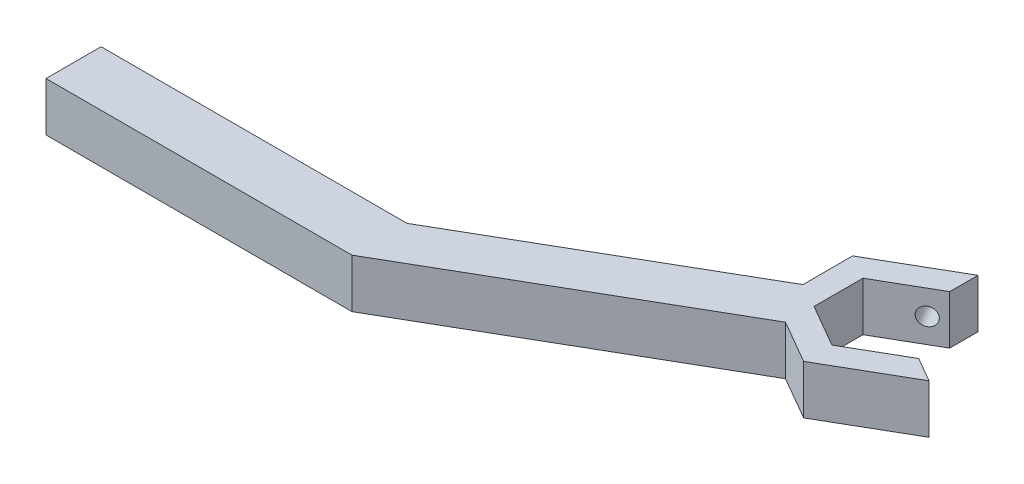
from build123d import *

# Parameters (mm, degrees)
SKETCH1_R           = 2.5
BOSS_EXTRUDE1_DEPTH = 4
BOSS_EXTRUDE2_START = 4
BOSS_EXTRUDE2_DEPTH = 4
SKETCH4_R           = 1.45
CUT_EXTRUDE1_DEPTH  = 4


# Read off the part's stored shape, not the designer's step: Boss-Extrude2
with BuildPart() as part:
    # Sketch1 → Boss-Extrude1 (new body)
    with BuildSketch(Plane(origin=(0, 0, 0), x_dir=(1, 0, 0), z_dir=(0, 1, 0))):
        Polygon((-4.5, -4.5), (45.5, -4.5), (90.417468245, 21.433112383), (97.448557159, 17.373711306), (110.438938215, 24.873711306), (106.438938215, 27.183112383), (104.376760389, 25.992513459), (97.448557159, 21.992513459), (90.520353928, 25.992513459), (90.520353928, 33.992513459), (99.510734985, 39.183112383), (99.510734985, 43.801914536), (86.520353928, 36.301914536), (86.520353928, 28.183112383), (45.5, 4.5), (-4.5, 4.5), align=None)
        with Locations(Location((0, 0, 0), (0, 0, 270))):
            Circle(SKETCH1_R, mode=Mode.SUBTRACT)
    extrude(amount=BOSS_EXTRUDE1_DEPTH)

    # Boss-Extrude2 outline → Boss-Extrude2 (add)
    with BuildSketch(Plane(origin=(0, 0, 0), x_dir=(1, 0, 0), z_dir=(0, 1, 0)).offset(BOSS_EXTRUDE2_START)):
        Polygon((99.510734985, 39.183112383), (99.510734985, 43.801914536), (86.520353928, 36.301914536), (86.520353928, 28.183112383), (45.5, 4.5), (-4.5, 4.5), (-4.5, -4.5), (45.5, -4.5), (90.417468245, 21.433112383), (97.448557159, 17.373711306), (110.438938215, 24.873711306), (106.438938215, 27.183112383), (97.448557159, 21.992513459), (90.520353928, 25.992513459), (90.520353928, 33.992513459), align=None)
    extrude(amount=BOSS_EXTRUDE2_DEPTH)

    # Sketch4 → Cut-Extrude1 (cut)
    with BuildSketch(Plane(origin=(5.910898385, 0, 10.237976321), x_dir=(-0.8660254037844413, 0, 0.4999999999999956), z_dir=(-0.4999999999999956, 0, -0.8660254037844413))):
        with Locations((-103.079781714, 4)):
            Circle(SKETCH4_R)
    extrude(amount=-CUT_EXTRUDE1_DEPTH, mode=Mode.SUBTRACT)


solid = part.part
